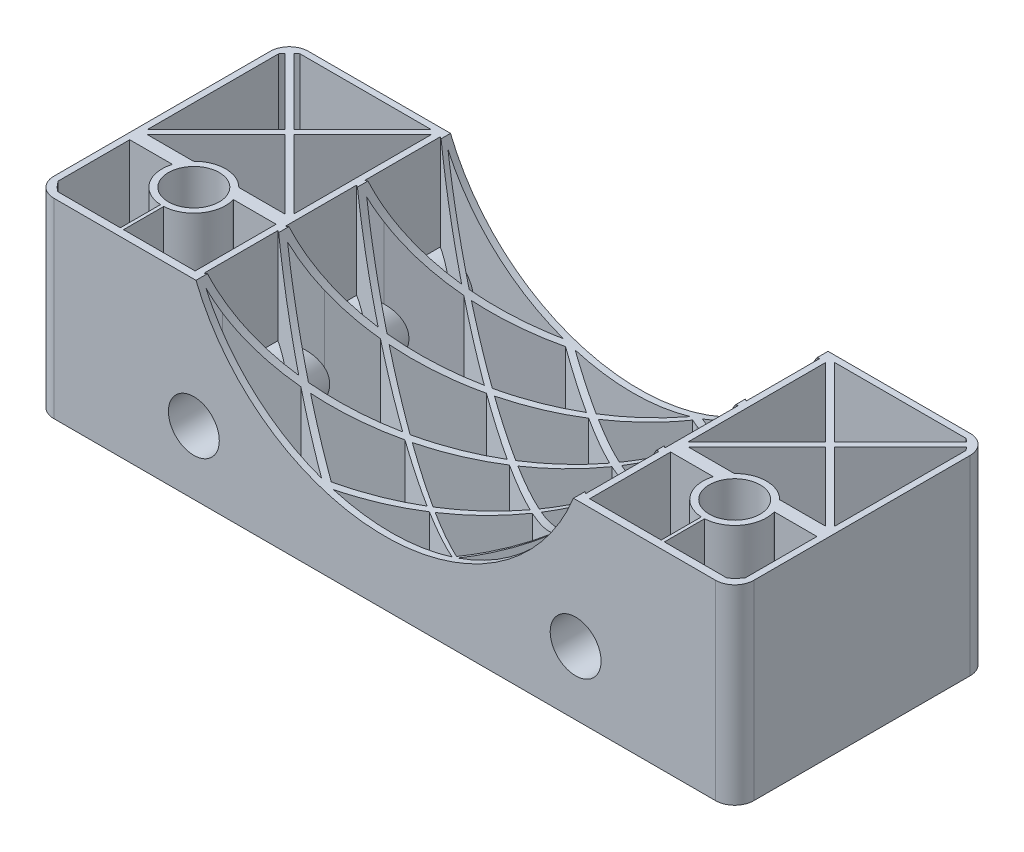
from build123d import *

# Parameters (mm, degrees)
SKETCH1_W           = 110
SKETCH1_H           = 40
BOSS_EXTRUDE1_DEPTH = 30
SKETCH2_R           = 32
CUT_EXTRUDE1_DEPTH  = 40
SKETCH3_R           = 4
CUT_EXTRUDE3_DEPTH  = 30
SKETCH7_R           = 4
CUT_EXTRUDE6_DEPTH  = 40
CUT_EXTRUDE7_DEPTH  = 30
CUT_EXTRUDE9_DEPTH  = 30
SKETCH12_R          = 5
BOSS_EXTRUDE3_DEPTH = 40
SKETCH15_R          = 4
CUT_EXTRUDE10_DEPTH = 40
BOSS_EXTRUDE4_DEPTH = 30
FILLET1_R           = 3


with BuildPart() as part:
    # Sketch1 → Boss-Extrude1 (new body)
    with BuildSketch(Plane(origin=(0, 0, 0), x_dir=(1, 0, 0), z_dir=(0, 1, 0))):
        with Locations((55, 20)):
            Rectangle(SKETCH1_W, SKETCH1_H)
    extrude(amount=BOSS_EXTRUDE1_DEPTH)

    # Sketch2 → Cut-Extrude1 (cut)
    with BuildSketch(Plane.XY):
        with Locations((55, 42)):
            Circle(SKETCH2_R)
    extrude(amount=-CUT_EXTRUDE1_DEPTH, mode=Mode.SUBTRACT)

    # Sketch3 → Cut-Extrude3 (cut)
    with BuildSketch(Plane.XZ):
        with Locations((12.5, -12.5)):
            Circle(SKETCH3_R)
    cut_extrude3 = extrude(amount=-CUT_EXTRUDE3_DEPTH, mode=Mode.SUBTRACT)

    # Mirror1: Cut-Extrude3 across plane
    add(cut_extrude3.mirror(Plane(origin=(55, 0, 0), x_dir=(0, 0, 1), z_dir=(1, 0, 0))), mode=Mode.SUBTRACT)

    # Sketch7 → Cut-Extrude6 (cut)
    with BuildSketch(Plane.XY):
        with Locations((25, 10)):
            Circle(SKETCH7_R)
        with Locations((85, 10)):
            Circle(SKETCH7_R)
    extrude(amount=-CUT_EXTRUDE6_DEPTH, mode=Mode.SUBTRACT)

    # Sketch9 → Cut-Extrude7 (cut)
    with BuildSketch(Plane.XZ):
        Polygon((1.707106781, -39), (12.5, -28.207106781), (23.292893219, -39), (21.79125531, -39), align=None)
        Polygon((1, -16.707106781), (11.792893219, -27.5), (1, -38.292893219), (1, -36.79125531), align=None)
        with BuildLine():
            Line((23.292893219, -16), (12.5, -26.792893219))
            Line((12.5, -26.792893219), (1.707106781, -16))
            Line((1.707106781, -16), (8.929285786, -16))
            ThreePointArc((8.929285786, -16), (12.5, -17.5), (16.070714214, -16))
            Line((16.070714214, -16), (23.292893219, -16))
        make_face()
        Polygon((24, -38.292893219), (13.207106781, -27.5), (24, -16.707106781), (24, -18.20874469), align=None)
        with BuildLine():
            Line((12.25, -1.199621128), (1, -1.199621128))
            Line((1, -1.199621128), (1, -13.924921606))
            Line((1, -13.924921606), (7.707339109, -13.924921606))
            Line((7.707339109, -13.924921606), (7.68918539, -13.862373953))
            ThreePointArc((7.68918539, -13.862373953), (8.437608263, -9.585043161), (12.25, -7.506253911))
            Line((12.25, -7.506253911), (12.25, -1.199621128))
        make_face()
        with BuildLine():
            Line((17.292660891, -13.924921606), (17.31081461, -13.862373953))
            ThreePointArc((17.31081461, -13.862373953), (16.562391737, -9.585043161), (12.75, -7.506253911))
            Line((12.75, -7.506253911), (12.75, -1.199621128))
            Line((12.75, -1.199621128), (24, -1.199621128))
            Line((24, -1.199621128), (24, -13.924921606))
            Line((24, -13.924921606), (17.292660891, -13.924921606))
        make_face()
        with BuildLine():
            Line((97.25, -1.199621128), (86, -1.199621128))
            Line((86, -1.199621128), (86, -13.924921606))
            Line((86, -13.924921606), (92.707339109, -13.924921606))
            Line((92.707339109, -13.924921606), (92.68918539, -13.862373953))
            ThreePointArc((92.68918539, -13.862373953), (93.437608263, -9.585043161), (97.25, -7.506253911))
            Line((97.25, -7.506253911), (97.25, -1.199621128))
        make_face()
        with BuildLine():
            Line((102.292660891, -13.924921606), (102.31081461, -13.862373953))
            ThreePointArc((102.31081461, -13.862373953), (101.562391737, -9.585043161), (97.75, -7.506253911))
            Line((97.75, -7.506253911), (97.75, -1.199621128))
            Line((97.75, -1.199621128), (109, -1.199621128))
            Line((109, -1.199621128), (109, -13.924921606))
            Line((109, -13.924921606), (102.292660891, -13.924921606))
        make_face()
        with BuildLine():
            Line((93.929285786, -16), (86.707106781, -16))
            Line((86.707106781, -16), (97.5, -26.792893219))
            Line((97.5, -26.792893219), (108.292893219, -16))
            Line((108.292893219, -16), (101.070714214, -16))
            ThreePointArc((101.070714214, -16), (97.5, -17.5), (93.929285786, -16))
        make_face()
        Polygon((86, -38.292893219), (86, -18.20874469), (86, -16.707106781), (96.792893219, -27.5), align=None)
        Polygon((109, -16.707106781), (109, -36.79125531), (109, -38.292893219), (98.207106781, -27.5), align=None)
        Polygon((86.707106781, -39), (88.20874469, -39), (108.292893219, -39), (97.5, -28.207106781), align=None)
    extrude(amount=-CUT_EXTRUDE7_DEPTH, mode=Mode.SUBTRACT)

    # Sketch11 → Cut-Extrude9 (cut)
    with BuildSketch(Plane.XZ):
        Polygon((74.831777691, -6.870491009), (84.013970911, -1), (65.436435115, -1), align=None)
        Polygon((85, -13.007711008), (85, -1.591842697), (75.754730915, -7.447179784), (84.828397962, -13.116678302), align=None)
        Polygon((74.303109193, -7.20848691), (65.00347679, -1.276449032), (55.748894389, -7.18560979), (65.113625115, -13.083639214), align=None)
        Polygon((55.184396802, -6.830081855), (64.570088732, -1), (45.92755138, -1), align=None)
        Polygon((75.037558184, -19.333861561), (84.195449509, -13.51860057), (75.214092745, -7.789583958), (65.986768251, -13.633556138), align=None)
        Polygon((85, -25.608337217), (85, -14.03180623), (81.349745928, -16.510200328), (75.974121895, -19.923721588), align=None)
        Polygon((47.722877132, -3.306365214), (45.005975516, -1.589808553), (35.983357785, -7.364283901), (45.064941258, -13.115953433), (54.24364247, -7.414447377), align=None)
        Polygon((64.184872748, -13.677422452), (54.820920186, -7.778132338), (45.765881351, -13.559882159), (55.111159638, -19.478558407), align=None)
        Polygon((74.104156828, -19.926571422), (65.053474994, -14.224641867), (55.934488469, -20), (64.973366916, -25.724623017), align=None)
        Polygon((35.050950115, -6.773759043), (44.07244862, -1), (25.860015592, -1), (27.529634929, -2.010259425), align=None)
        Polygon((80.649584856, -28.390632809), (84.068474608, -26.204091624), (75.040582112, -20.516519351), (65.907331161, -26.316133705), (74.946238074, -32.04077475), align=None)
        Polygon((54.181077526, -20.073191796), (44.835197816, -14.154134647), (35.728490581, -19.968875355), (45.103769575, -25.876626056), align=None)
        Polygon((85, -38.408157303), (85, -26.790952621), (82.228397155, -28.567458704), (75.878645743, -32.631299607), align=None)
        Polygon((64.040106421, -26.31724343), (55, -20.591842697), (45.881647659, -26.36679918), (54.956574992, -32.085285888), align=None)
        Polygon((44.12138996, -13.702056338), (35.053761926, -7.95922525), (28.423168594, -12.202804983), (25.932883022, -13.794637913), (29.509301375, -16.049907246), (34.886630018, -19.438384226), align=None)
        Polygon((34.121354257, -7.368700393), (25, -1.591842697), (25, -13.206367117), align=None)
        Polygon((44.174383673, -26.470814335), (34.797457648, -20.563350939), (25.961839119, -26.204998289), (27.626895365, -27.28758015), (35.257903909, -32.171425619), align=None)
        Polygon((66.85354378, -37.220099098), (74.016642215, -32.635716099), (64.974070666, -26.908754119), (55.892895673, -32.67530024), (64.990420354, -38.408026471), align=None)
        Polygon((54.025105444, -32.676769051), (44.947934097, -26.958151102), (35.983357785, -32.635716099), (45.001054032, -38.407041698), align=None)
        Polygon((25, -25.579632277), (33.942595105, -20.024787537), (25, -14.390952621), align=None)
        Polygon((65.929850142, -39), (84.065511531, -39), (74.949049885, -33.226240957), (67.451195268, -38.024867912), align=None)
        Polygon((25, -38.729655361), (34.329869874, -32.764749603), (26.854833561, -27.980726362), (25, -26.819143988), align=None)
        Polygon((64.061979967, -39), (54.961530728, -33.26671698), (47.140316953, -38.233187727), (45.92755138, -39), align=None)
        Polygon((42.539405901, -38.01885266), (35.050950115, -33.226240957), (25.934488469, -39), (44.06726143, -39), align=None)
    extrude(amount=-CUT_EXTRUDE9_DEPTH, mode=Mode.SUBTRACT)

    # Sketch12 → Boss-Extrude3 (add)
    with BuildSketch(Plane.XY):
        with Locations((25, 10)):
            Circle(SKETCH12_R)
        with Locations((85, 10)):
            Circle(SKETCH12_R)
    extrude(amount=-BOSS_EXTRUDE3_DEPTH)

    # Sketch15 → Cut-Extrude10 (cut)
    with BuildSketch(Plane.XY):
        with Locations((25, 10)):
            Circle(SKETCH15_R)
        with Locations((85, 10)):
            Circle(SKETCH15_R)
    extrude(amount=-CUT_EXTRUDE10_DEPTH, mode=Mode.SUBTRACT)

    # Sketch16 → Boss-Extrude4 (add)
    with BuildSketch(Plane(origin=(0, 30, 0), x_dir=(1, 0, 0), z_dir=(0, 1, 0))):
        with BuildLine():
            Line((104, 0), (110, 0))
            Line((110, 0), (110, 6))
            ThreePointArc((110, 6), (108.242640687, 1.757359313), (104, 0))
        make_face()
        with BuildLine():
            Line((110, 40), (110, 34))
            ThreePointArc((110, 34), (108.242640687, 38.242640687), (104, 40))
            Line((104, 40), (110, 40))
        make_face()
        with BuildLine():
            Line((6, 40), (0, 40))
            Line((0, 40), (0, 34))
            ThreePointArc((0, 34), (1.757359313, 38.242640687), (6, 40))
        make_face()
        with BuildLine():
            Line((0, 0), (0, 6))
            ThreePointArc((0, 6), (1.757359313, 1.757359313), (6, 0))
            Line((6, 0), (0, 0))
        make_face()
    extrude(amount=-BOSS_EXTRUDE4_DEPTH)

    # Fillet1
    fillet1_edges = [part.edges().sort_by_distance(p)[0] for p in [
        (0, 15, 0),
        (110, 15, 0),
        (0, 15, -40),
        (110, 15, -40),
    ]]
    fillet(fillet1_edges, radius=FILLET1_R)


solid = part.part
